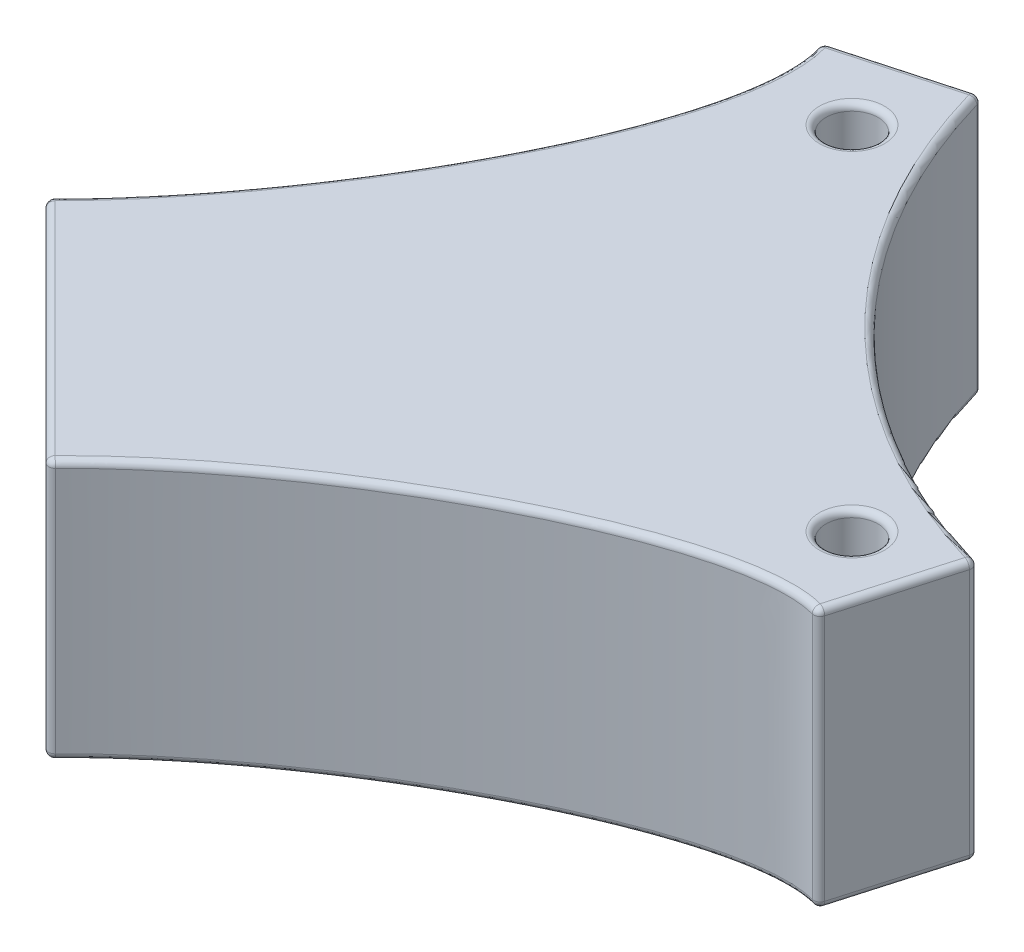
from build123d import *

# Parameters (mm, degrees)
SKETCH1_R           = 10.16
BOSS_EXTRUDE1_DEPTH = 101.6
SKETCH3_W           = 25.4
SKETCH3_H           = 25.4
CUT_EXTRUDE1_DEPTH  = 63.5
FILLET1_R           = 2.54


with BuildPart() as part:
    # Sketch1 → Boss-Extrude1 (new body)
    with BuildSketch(Plane(origin=(0, 0, 0), x_dir=(1, 0, 0), z_dir=(0, 1, 0))):
        with BuildLine():
            ThreePointArc((-63.189745239, -219.693004205), (-162.413936351, -160.871604949), (-220.285921603, -61.090692771))
            Line((-220.285921603, -61.090692771), (-269.238348626, -74.666402276))
            add(Edge.make_bspline(
                [(-269.238348626, -74.666402276), (-254.006323645, -115.92182656), (-312.778773497, -224.027499661), (-368.190500964, -278.387939753)],
                knots=[0, 0, 0, 0, 1, 1, 1, 1], degree=3))
            Line((-368.190500964, -278.387939753), (-278.387939753, -368.190500964))
            add(Edge.make_bspline(
                [(-278.387939753, -368.190500964), (-223.288585663, -310.85243892), (-114.547711842, -254.924111506), (-77.231910848, -268.513671806)],
                knots=[0.029012762, 0.029012762, 0.029012762, 0.029012762, 1.029012762, 1.029012762, 1.029012762, 1.029012762], degree=3))
            Line((-77.231910848, -268.513671806), (-63.189745239, -219.693004205))
        make_face()
        with Locations((-97.201591821, -234.665401258)):
            Circle(SKETCH1_R, mode=Mode.SUBTRACT)
        with Locations((-234.665401258, -97.201591821)):
            Circle(SKETCH1_R, mode=Mode.SUBTRACT)
    extrude(amount=BOSS_EXTRUDE1_DEPTH)

    # Sketch3 → Cut-Extrude1 (cut)
    with BuildSketch(Plane(origin=(-323.289220358, 0, 323.289220358), x_dir=(0.7071067811865479, 0, 0.7071067811865471), z_dir=(-0.7071067811865471, 0, 0.7071067811865479))):
        with Locations((-38.1, 76.2)):
            Rectangle(SKETCH3_W, SKETCH3_H)
        with Locations((-38.1, 25.4)):
            Rectangle(SKETCH3_W, SKETCH3_H)
        with Locations((38.1, 76.2)):
            Rectangle(SKETCH3_W, SKETCH3_H)
        with Locations((38.1, 25.4)):
            Rectangle(SKETCH3_W, SKETCH3_H)
    extrude(amount=-CUT_EXTRUDE1_DEPTH, mode=Mode.SUBTRACT)

    # Fillet1
    fillet1_edges = [part.edges().sort_by_distance(p)[0] for p in [
        (-269.238348626, 50.8, 74.666402276),
        (-220.285921603, 50.8, 61.090692771),
        (-63.189745239, 50.8, 219.693004205),
        (-77.231910848, 50.8, 268.513671806),
        (-368.190500964, 50.8, 278.387939753),
        (-278.387939753, 50.8, 368.190500964),
        (-341.249732601, 76.2, 305.328708116),
        (-350.229988722, 88.9, 296.348451995),
        (-359.210244843, 76.2, 287.368195874),
        (-350.229988722, 63.5, 296.348451995),
        (-287.368195874, 25.4, 359.210244843),
        (-296.348451995, 38.1, 350.229988722),
        (-305.328708116, 25.4, 341.249732601),
        (-296.348451995, 12.7, 350.229988722),
        (-287.368195874, 76.2, 359.210244843),
        (-296.348451995, 88.9, 350.229988722),
        (-305.328708116, 76.2, 341.249732601),
        (-296.348451995, 63.5, 350.229988722),
        (-341.249732601, 25.4, 305.328708116),
        (-350.229988722, 38.1, 296.348451995),
        (-359.210244843, 25.4, 287.368195874),
        (-350.229988722, 12.7, 296.348451995),
        (-244.825401258, 0, 97.201591821),
        (-107.361591821, 0, 234.665401258),
        (-70.210828044, 0, 244.103338006),
        (-162.413936351, 0, 160.871604949),
        (-244.762135115, 0, 67.878547524),
        (-299.183321541, 0, 184.781124868),
        (-323.289220358, 0, 323.289220358),
        (-186.004241677, 0, 299.592371351),
        (-244.825401258, 101.6, 97.201591821),
        (-107.361591821, 101.6, 234.665401258),
        (-323.289220358, 101.6, 323.289220358),
        (-299.183321541, 101.6, 184.781124868),
        (-244.762135115, 101.6, 67.878547524),
        (-162.413936351, 101.6, 160.871604949),
        (-70.210828044, 101.6, 244.103338006),
        (-186.004241677, 101.6, 299.592371351),
    ]]
    fillet(fillet1_edges, radius=FILLET1_R)


solid = part.part
